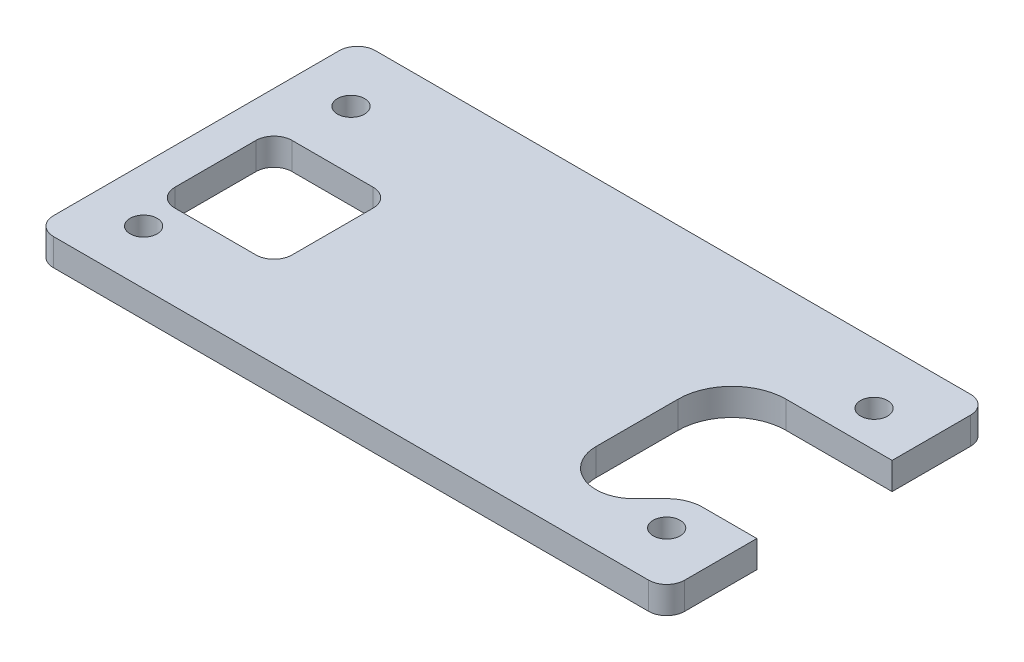
from build123d import *

# Parameters (mm, degrees)
SKETCH1_W           = 70
SKETCH1_H           = 35.7
SKETCH1_R           = 1.5
BOSS_EXTRUDE1_DEPTH = 3
SKETCH2_W           = 13
SKETCH2_H           = 13
CUT_EXTRUDE1_DEPTH  = 40.403331077
FILLET1_R           = 2
FILLET2_R           = 2


with BuildPart() as part:
    # Sketch1 → Boss-Extrude1 (new body)
    with BuildSketch(Plane(origin=(0, 0, 0), x_dir=(1, 0, 0), z_dir=(0, 1, 0))):
        Rectangle(SKETCH1_W, SKETCH1_H)
        with Locations((-29, -11.85)):
            Circle(SKETCH1_R, mode=Mode.SUBTRACT)
        with Locations((29, -11.85)):
            Circle(SKETCH1_R, mode=Mode.SUBTRACT)
        with Locations((29, 11.15)):
            Circle(SKETCH1_R, mode=Mode.SUBTRACT)
        with Locations((-29, 11.15)):
            Circle(SKETCH1_R, mode=Mode.SUBTRACT)
    extrude(amount=BOSS_EXTRUDE1_DEPTH)

    # Sketch2 → Cut-Extrude1 (cut, through all)
    with BuildSketch(Plane(origin=(0, 3, 0), x_dir=(1, 0, 0), z_dir=(0, 1, 0))):
        with Locations((-24.5, -1.89)):
            Rectangle(SKETCH2_W, SKETCH2_H)
        with BuildLine():
            Line((17.25, 1.15), (17.25, -7.934129881))
            ThreePointArc((17.25, -7.934129881), (19.809314312, -11.764414428), (24.327442995, -10.865702756))
            Line((24.327442995, -10.865702756), (26.171572875, -9.021572875))
            ThreePointArc((26.171572875, -9.021572875), (27.469266271, -8.15448187), (29, -7.85))
            Line((29, -7.85), (35, -7.85))
            Line((35, -7.85), (35, 7.15))
            Line((35, 7.15), (23.25, 7.15))
            ThreePointArc((23.25, 7.15), (19.007359313, 5.392640687), (17.25, 1.15))
        make_face()
    extrude(amount=-CUT_EXTRUDE1_DEPTH, mode=Mode.SUBTRACT)

    # Fillet1
    fillet1_edges = [part.edges().sort_by_distance(p)[0] for p in [
        (-18, 1.5, 8.39),
        (-31, 1.5, 8.39),
        (-18, 1.5, -4.61),
        (-31, 1.5, -4.61),
    ]]
    fillet(fillet1_edges, radius=FILLET1_R)

    # Fillet2
    fillet2_edges = [part.edges().sort_by_distance(p)[0] for p in [
        (35, 1.5, -17.85),
        (35, 1.5, 17.85),
        (-35, 1.5, 17.85),
        (-35, 1.5, -17.85),
    ]]
    fillet(fillet2_edges, radius=FILLET2_R)


solid = part.part
